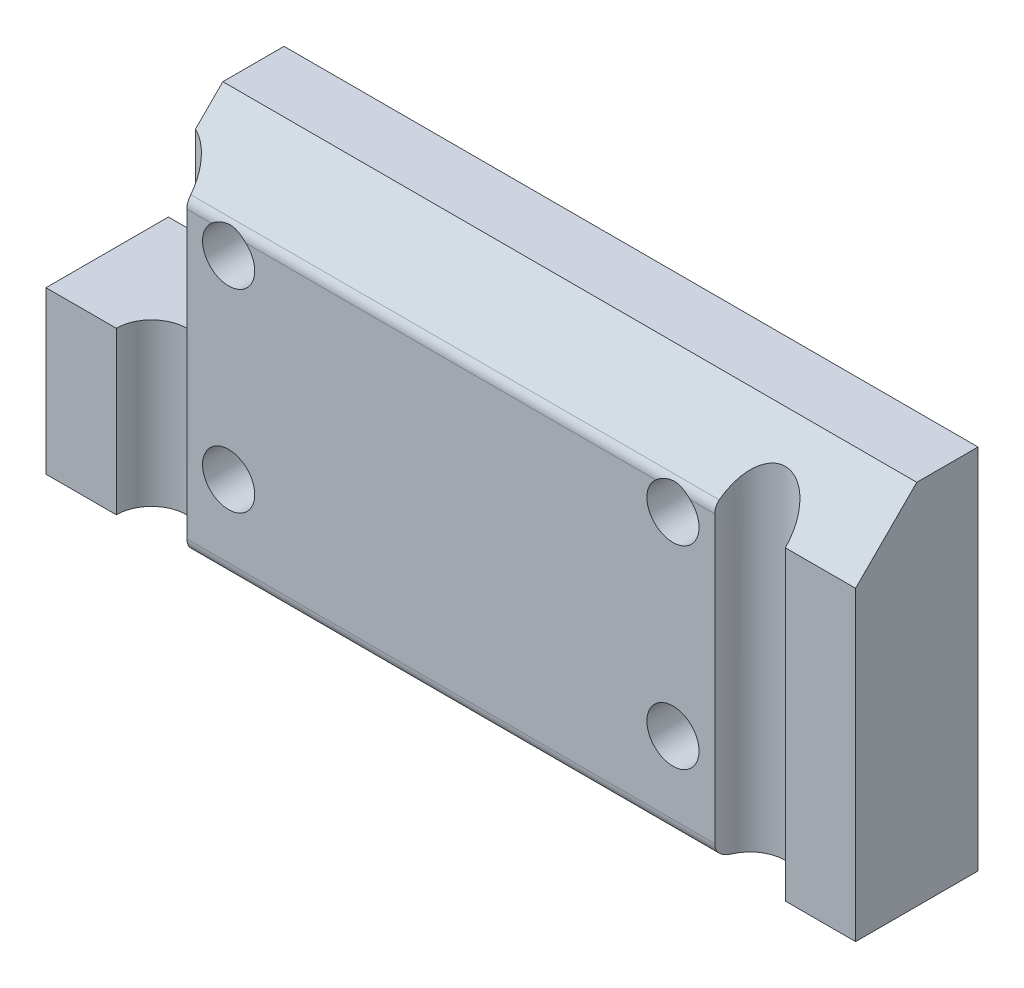
from build123d import *

# Parameters (mm, degrees)
BOSS_EXTRUDE1_DEPTH       = 21
F_6_32_TAPPED_HOLE1_D     = 2.7051
F_6_32_TAPPED_HOLE1_DEPTH = 9.398
F_6_32_TAPPED_HOLE1_TIP   = 0.81269403
F_6_CLEARANCE_HOLE1_D     = 3.6576
FILLET1_R                 = 0.75
SKETCH8_W                 = 6
SKETCH8_H                 = 10.668
CUT_EXTRUDE1_DEPTH        = 24.917527635


with BuildPart() as part:
    # Sketch1 → Boss-Extrude1 (new, symmetric)
    with BuildSketch(Plane(origin=(0, 0, 0), x_dir=(0, 0, -1), z_dir=(1, 0, 0))):
        Polygon((0, 6.35), (3.175, 9.525), (6.35, 9.525), (6.35, -9.525), (0, -9.525), align=None)
    extrude(amount=BOSS_EXTRUDE1_DEPTH, both=True)

    # #6-32 Tapped Hole1
    with Locations(Plane(origin=(0, 0, -6.35), x_dir=(-1, 0, 0), z_dir=(0, 0, -1))):
        with Locations((11.525, -5.025), (-11.525, 5.025), (-11.525, -5.025), (11.525, 5.025)):
            Hole(F_6_32_TAPPED_HOLE1_D / 2, depth=F_6_32_TAPPED_HOLE1_DEPTH)
            with Locations((0, 0, -(F_6_32_TAPPED_HOLE1_DEPTH + F_6_32_TAPPED_HOLE1_TIP / 2))):  # 118° drill point
                Cone(0, F_6_32_TAPPED_HOLE1_D / 2, F_6_32_TAPPED_HOLE1_TIP, mode=Mode.SUBTRACT)

    # #6 Clearance Hole1 (through all)
    with Locations(Plane(origin=(0, -9.525, 0), x_dir=(-1, 0, 0), z_dir=(0, -1, 0))):
        with Locations((-15.525, 0), (15.525, 0)):
            Hole(F_6_CLEARANCE_HOLE1_D / 2)

    # Fillet1
    # the kernel refuses this fillet: 0.75 mm, written as the material it takes off along each edge
    with BuildSketch(Plane(origin=(-14.472850429, 6.35, 0), x_dir=(0, 0.707106781186552, -0.7071067811865431), z_dir=(1, 0, 0)), Plane(origin=(11.019949465, 6.35, 0), x_dir=(0, 0.707106781186552, -0.7071067811865431), z_dir=(1, 0, 0))) as fillet1_piece_1:
        with BuildLine():
            CenterArc((FILLET1_R * 0.414213562373, -FILLET1_R), FILLET1_R, 90, 45)
            Line((-FILLET1_R * 0.292893218813, -FILLET1_R * 0.292893218813), (0, 0))
            Line((0, 0), (FILLET1_R * 0.414213562373, 0))
        make_face()
    extrude(amount=3.452900965, mode=Mode.SUBTRACT)
    with BuildSketch(Plane(origin=(-12.030050535, 6.35, 0), x_dir=(0, 0.707106781186552, -0.7071067811865431), z_dir=(1, 0, 0))) as fillet1_piece_2:
        with BuildLine():
            CenterArc((FILLET1_R * 0.414213562373, -FILLET1_R), FILLET1_R, 90, 45)
            Line((-FILLET1_R * 0.292893218813, -FILLET1_R * 0.292893218813), (0, 0))
            Line((0, 0), (FILLET1_R * 0.414213562373, 0))
        make_face()
    extrude(amount=24.060101071, mode=Mode.SUBTRACT)
    with BuildSketch(Plane(origin=(-15.5712, -9.525, 0), x_dir=(0, 1, 0), z_dir=(1, 0, 0))) as fillet1_piece_3:
        with BuildLine():
            CenterArc((FILLET1_R, -FILLET1_R), FILLET1_R, 90, 90)
            Line((0, -FILLET1_R), (0, 0))
            Line((0, 0), (FILLET1_R, 0))
        make_face()
    extrude(amount=31.1424, mode=Mode.SUBTRACT)

    # Sketch8 → Cut-Extrude1 (cut, through all)
    with BuildSketch(Plane.XY):
        with Locations((-18, 4.191)):
            Rectangle(SKETCH8_W, SKETCH8_H)
    extrude(amount=-CUT_EXTRUDE1_DEPTH, mode=Mode.SUBTRACT)


solid = part.part
